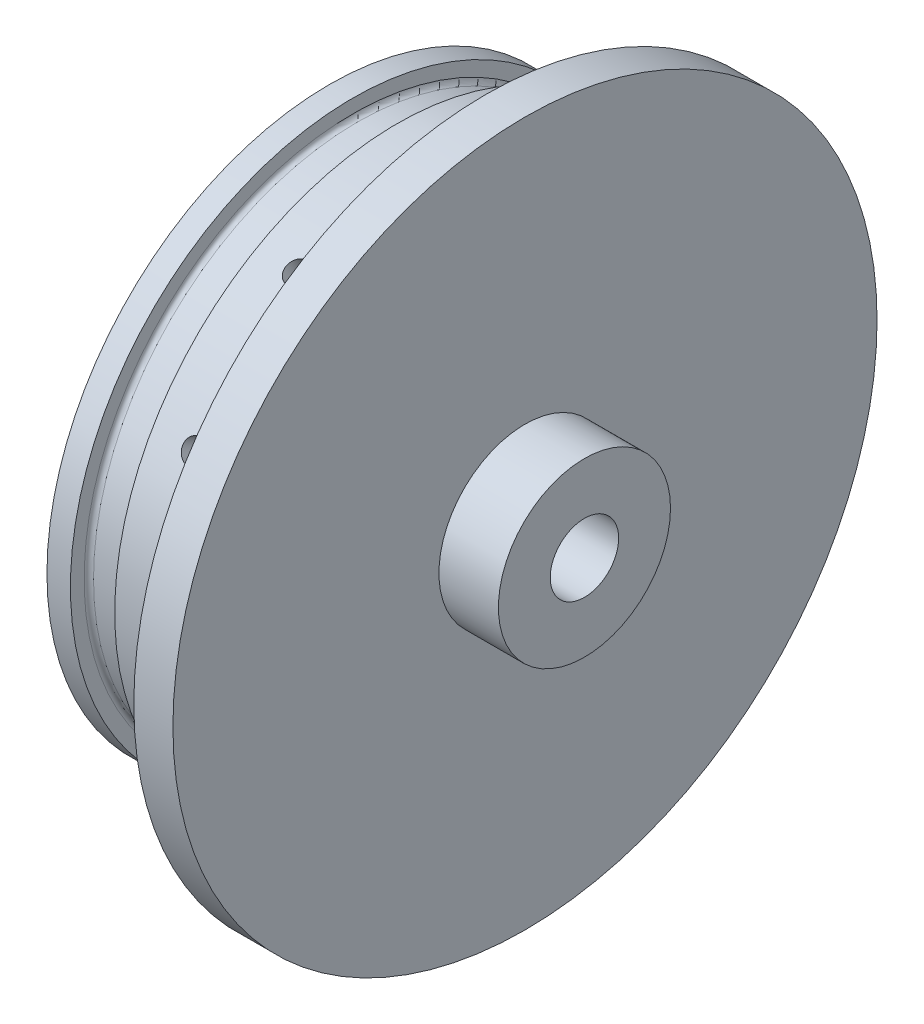
from build123d import *

# Parameters (mm, degrees)
SKETCH1_R               = 57.15
BOSS_EXTRUDE1_DEPTH     = 6.35
SKETCH2_R               = 45.847
BOSS_EXTRUDE2_DEPTH     = 25.4
SKETCH11_R              = 1.89865
CUT_EXTRUDE3_DEPTH      = 10.16
CIRPATTERN1_COUNT       = 12
CUT_EXTRUDE4_DEPTH      = 87.83494404
CUT_EXTRUDE4_DEPTH_BACK = 87.83494404
SKETCH15_R              = 5.55625
BOSS_EXTRUDE3_START     = 9.652
SKETCH17_R              = 13.97
SKETCH17_R_2            = 5.55625
BOSS_EXTRUDE3_DEPTH     = 9.652
SKETCH18_R              = 38.1
CUT_EXTRUDE5_DEPTH      = 6.604
SKETCH19_R              = 1.1303
CUT_EXTRUDE6_DEPTH      = 6.35
SKETCH20_R              = 23.495
CUT_EXTRUDE7_DEPTH      = 19.05
FILLET1_R               = 2.54
CHAMFER1_SIZE           = 5.08


with BuildPart() as part:
    # Sketch1 → Boss-Extrude1 (new body)
    with BuildSketch(Plane(origin=(0, 0, 0), x_dir=(0, 0, -1), z_dir=(1, 0, 0))):
        Circle(SKETCH1_R)
    extrude(amount=BOSS_EXTRUDE1_DEPTH)

    # Sketch2 → Boss-Extrude2 (add)
    with BuildSketch(Plane.ZY):
        Circle(SKETCH2_R)
    extrude(amount=BOSS_EXTRUDE2_DEPTH)

    # Sketch11 → Cut-Extrude3 (cut)
    with BuildSketch(Plane(origin=(0, 0, -45.847), x_dir=(-1, 0, 0), z_dir=(0, 0, -1))):
        with Locations((7.62, 0)):
            Circle(SKETCH11_R)
    cut_extrude3 = extrude(amount=-CUT_EXTRUDE3_DEPTH, mode=Mode.SUBTRACT)

    # CirPattern1: Cut-Extrude3 ×12 about axis
    cirpattern1_axis = Axis((0, 0, 0), (-1, 0, 0))
    for i in range(1, CIRPATTERN1_COUNT):
        add(cut_extrude3.rotate(cirpattern1_axis, i * 360 / CIRPATTERN1_COUNT), mode=Mode.SUBTRACT)

    # Sketch15 → Cut-Extrude4 (cut, two sides: drawn at the far end of the back side and taken through both)
    with BuildSketch(Plane(origin=(6.35, 0, 0), x_dir=(0, 0, -1), z_dir=(1, 0, 0)).offset(-CUT_EXTRUDE4_DEPTH_BACK)):
        Circle(SKETCH15_R)
    extrude(amount=CUT_EXTRUDE4_DEPTH + CUT_EXTRUDE4_DEPTH_BACK, mode=Mode.SUBTRACT)

    # Sketch16 → Cut-Revolve1 (revolve, cut)
    with BuildSketch(Plane.XY):
        with BuildLine():
            Line((-21.59, 45.847), (-14.4018, 45.847))
            Line((-14.4018, 45.847), (-14.4018, 43.6245))
            ThreePointArc((-14.4018, 43.6245), (-14.624984633, 43.085684633), (-15.1638, 42.8625))
            Line((-15.1638, 42.8625), (-20.828, 42.8625))
            ThreePointArc((-20.828, 42.8625), (-21.366815367, 43.085684633), (-21.59, 43.6245))
            Line((-21.59, 43.6245), (-21.59, 45.847))
        make_face()
    revolve(axis=Axis((0, 0, 0), (-1, 0, 0)), mode=Mode.SUBTRACT)

    # Sketch17 → Boss-Extrude3 (add)
    with BuildSketch(Plane(origin=(6.35, 0, 0), x_dir=(0, 0, -1), z_dir=(1, 0, 0)).offset(BOSS_EXTRUDE3_START)):
        Circle(SKETCH17_R)
        Circle(SKETCH17_R_2, mode=Mode.SUBTRACT)
    extrude(amount=-BOSS_EXTRUDE3_DEPTH)

    # Sketch18 → Cut-Extrude5 (cut)
    with BuildSketch(Plane.ZY.offset(25.4)):
        Circle(SKETCH18_R)
    extrude(amount=-CUT_EXTRUDE5_DEPTH, mode=Mode.SUBTRACT)

    # Sketch19 → Cut-Extrude6 (cut)
    with BuildSketch(Plane.ZY.offset(18.796)):
        with Locations((0, 33.274)):
            Circle(SKETCH19_R)
        with Locations((23.528271037, 23.528271037)):
            Circle(SKETCH19_R)
        with Locations((33.274, 0)):
            Circle(SKETCH19_R)
        with Locations((23.528271037, -23.528271037)):
            Circle(SKETCH19_R)
        with Locations((0, -33.274)):
            Circle(SKETCH19_R)
        with Locations((-23.528271037, -23.528271037)):
            Circle(SKETCH19_R)
        with Locations((-33.274, 0)):
            Circle(SKETCH19_R)
        with Locations((-23.528271037, 23.528271037)):
            Circle(SKETCH19_R)
    extrude(amount=-CUT_EXTRUDE6_DEPTH, mode=Mode.SUBTRACT)

    # Sketch20 → Cut-Extrude7 (cut)
    with BuildSketch(Plane.ZY.offset(18.796)):
        Circle(SKETCH20_R)
    extrude(amount=-CUT_EXTRUDE7_DEPTH, mode=Mode.SUBTRACT)

    # Fillet1
    fillet1_edges = [part.edges().sort_by_distance(p)[0] for p in [
        (0.254, 0, -23.495),
    ]]
    fillet(fillet1_edges, radius=FILLET1_R)

    # Chamfer1
    chamfer1_edges = [part.edges().sort_by_distance(p)[0] for p in [
        (0.254, 0, 5.55625),
    ]]
    chamfer(chamfer1_edges, length=CHAMFER1_SIZE)


solid = part.part
